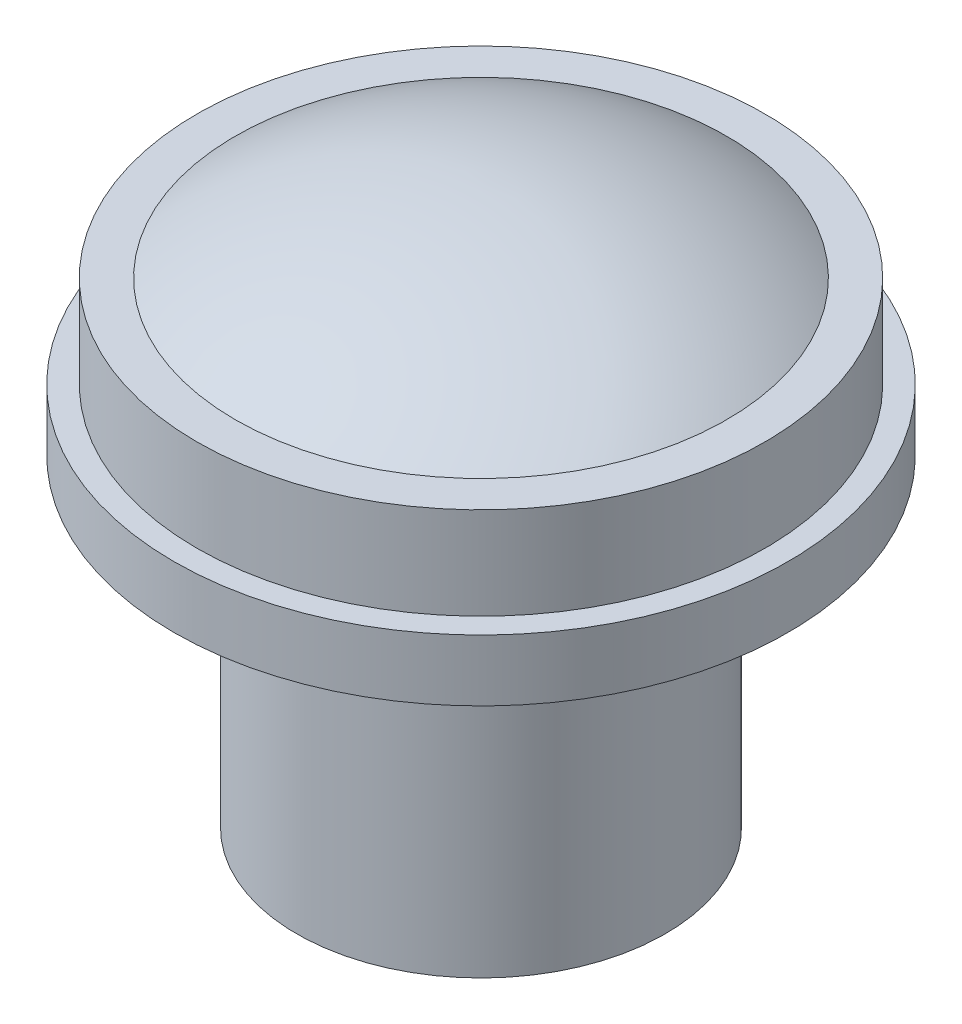
from build123d import *

# Parameters (mm, degrees)
SKETCH1_R           = 6
SKETCH1_R_2         = 2.25
BOSS_EXTRUDE1_DEPTH = 10.5
SKETCH2_R           = 9.25
SKETCH2_R_2         = 8
BOSS_EXTRUDE2_DEPTH = 5
SKETCH2_6_R         = 8
SKETCH2_6_R_2       = 6
SKETCH2_6_R_3       = 2.25
BOSS_EXTRUDE4_DEPTH = 5
SKETCH2_8_R         = 2.25
BOSS_EXTRUDE7_DEPTH = 0.1
SKETCH2_10_R        = 10
SKETCH2_10_R_2      = 9.25
BOSS_EXTRUDE8_DEPTH = 2
DOME2_FACE_RADIUS   = 2.25
DOME2_HEIGHT        = 2.5
DOME1_FACE_RADIUS   = 8
DOME1_HEIGHT        = 2.5


with BuildPart() as part:
    # Sketch1 → Boss-Extrude1 (new body)
    with BuildSketch(Plane(origin=(0, 0, 0), x_dir=(1, 0, 0), z_dir=(0, 1, 0))):
        with Locations(Location((0, 0, 0), (0, 0, 90))):
            Circle(SKETCH1_R)
        with Locations(Location((0, 0, 0), (0, 0, 90))):
            Circle(SKETCH1_R_2, mode=Mode.SUBTRACT)
    extrude(amount=BOSS_EXTRUDE1_DEPTH)


with BuildPart() as body_2:
    # Sketch2 → Boss-Extrude2 (new body)
    with BuildSketch(Plane(origin=(0, 10.5, 0), x_dir=(1, 0, 0), z_dir=(0, 1, 0))):
        with Locations(Location((0, 0, 0), (0, 0, 270))):
            Circle(SKETCH2_R)
        with Locations(Location((0, 0, 0), (0, 0, 270))):
            Circle(SKETCH2_R_2, mode=Mode.SUBTRACT)
    extrude(amount=BOSS_EXTRUDE2_DEPTH)


with BuildPart() as body_3:
    # Sketch2<6> → Boss-Extrude4 (new body)
    # profile 1 of 3: a face of its own
    with BuildSketch(Plane(origin=(0, 10.5, 0), x_dir=(1, 0, 0), z_dir=(0, 1, 0))):
        with Locations(Location((0, 0, 0), (0, 0, 270))):
            Circle(SKETCH2_6_R)
        with Locations(Location((0, 0, 0), (0, 0, 90))):
            Circle(SKETCH2_6_R_2, mode=Mode.SUBTRACT)
    # profile 2 of 3: a face of its own
    with BuildSketch(Plane(origin=(0, 10.5, 0), x_dir=(1, 0, 0), z_dir=(0, 1, 0))):
        with Locations(Location((0, 0, 0), (0, 0, 90))):
            Circle(SKETCH2_6_R_2)
        with Locations(Location((0, 0, 0), (0, 0, 90))):
            Circle(SKETCH2_6_R_3, mode=Mode.SUBTRACT)
    # profile 3 of 3: a face of its own
    with BuildSketch(Plane(origin=(0, 10.5, 0), x_dir=(1, 0, 0), z_dir=(0, 1, 0))):
        with Locations(Location((0, 0, 0), (0, 0, 90))):
            Circle(SKETCH2_6_R_3)
    extrude(amount=BOSS_EXTRUDE4_DEPTH)

    # Dome1: a dome of height H over a round flat face of radius A is a cap of a sphere of radius (A * A + H * H) / (2 * H)
    dome1_r = (DOME1_FACE_RADIUS * DOME1_FACE_RADIUS + DOME1_HEIGHT * DOME1_HEIGHT) / (2 * DOME1_HEIGHT)
    dome1_base = Plane((0, 15.5, 0), z_dir=(0, 1, 0))
    with Locations(dome1_base.offset(DOME1_HEIGHT - dome1_r)):
        dome1_ball = Sphere(dome1_r, mode=Mode.PRIVATE)
    add(split(dome1_ball, bisect_by=dome1_base, keep=Keep.TOP, mode=Mode.PRIVATE))


with BuildPart() as body_4:
    # Sketch2<8> → Boss-Extrude7 (new body)
    with BuildSketch(Plane(origin=(0, 10.5, 0), x_dir=(1, 0, 0), z_dir=(0, 1, 0))):
        with Locations(Location((0, 0, 0), (0, 0, 270))):
            Circle(SKETCH2_8_R)
    extrude(amount=-BOSS_EXTRUDE7_DEPTH)

    # Dome2: a dome of height H over a round flat face of radius A is a cap of a sphere of radius (A * A + H * H) / (2 * H)
    dome2_r = (DOME2_FACE_RADIUS * DOME2_FACE_RADIUS + DOME2_HEIGHT * DOME2_HEIGHT) / (2 * DOME2_HEIGHT)
    dome2_base = Plane((0, 10.5, 0), z_dir=(0, 1, 0))
    with Locations(dome2_base.offset(DOME2_HEIGHT - dome2_r)):
        dome2_ball = Sphere(dome2_r, mode=Mode.PRIVATE)
    add(split(dome2_ball, bisect_by=dome2_base, keep=Keep.TOP, mode=Mode.PRIVATE))


with BuildPart() as body_5:
    # Sketch2<10> → Boss-Extrude8 (new body)
    with BuildSketch(Plane(origin=(0, 10.5, 0), x_dir=(1, 0, 0), z_dir=(0, 1, 0))):
        with Locations(Location((0, 0, 0), (0, 0, 270))):
            Circle(SKETCH2_10_R)
        with Locations(Location((0, 0, 0), (0, 0, 270))):
            Circle(SKETCH2_10_R_2, mode=Mode.SUBTRACT)
    extrude(amount=BOSS_EXTRUDE8_DEPTH)


solid = Compound([part.part, body_2.part, body_3.part, body_4.part, body_5.part])
